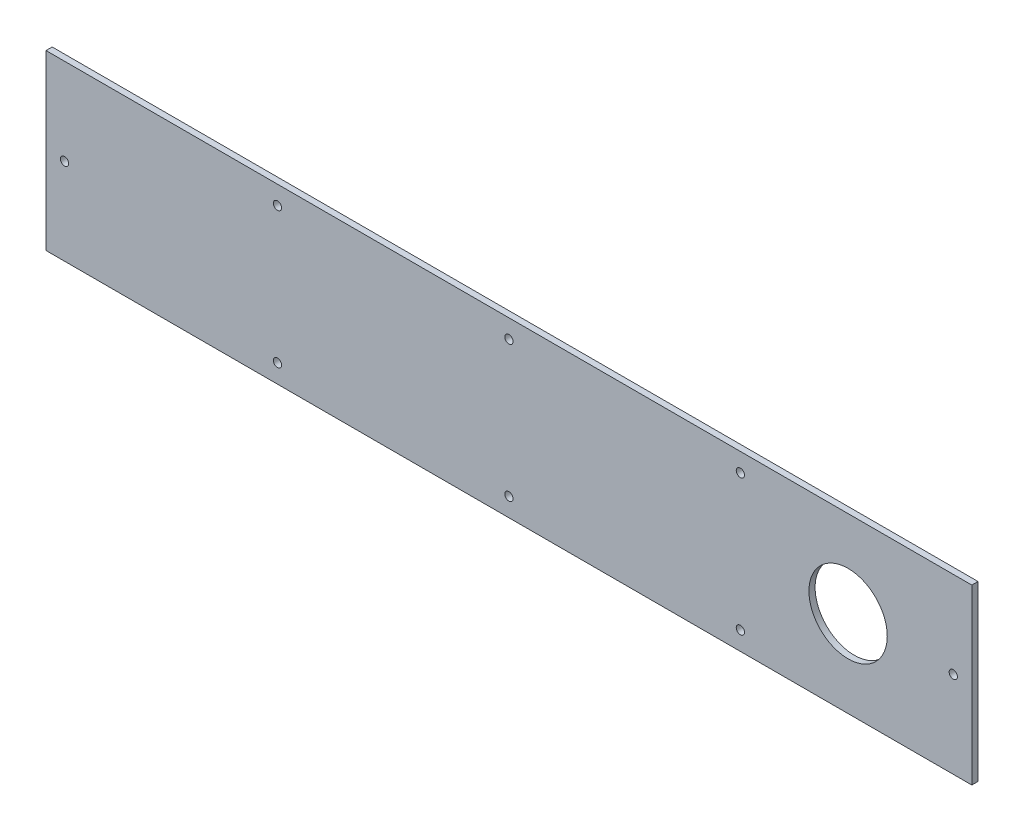
from build123d import *

# Parameters (mm, degrees)
SCHIZZO1_W                   = 449
SCHIZZO1_H                   = 84
SCHIZZO1_R                   = 2
SCHIZZO1_R_2                 = 19
ESTRUSIONE_ESTRUSIONE1_DEPTH = 3


with BuildPart() as part:
    # Schizzo1 → Estrusione-Estrusione1 (new body)
    with BuildSketch(Plane.XY):
        with Locations((224.5, 42)):
            Rectangle(SCHIZZO1_W, SCHIZZO1_H)
        with Locations((9, 42)):
            Circle(SCHIZZO1_R, mode=Mode.SUBTRACT)
        with Locations((224.5, 75)):
            Circle(SCHIZZO1_R, mode=Mode.SUBTRACT)
        with Locations((224.5, 9)):
            Circle(SCHIZZO1_R, mode=Mode.SUBTRACT)
        with Locations((440, 42)):
            Circle(SCHIZZO1_R, mode=Mode.SUBTRACT)
        with Locations((112.25, 75)):
            Circle(SCHIZZO1_R, mode=Mode.SUBTRACT)
        with Locations((336.75, 75)):
            Circle(SCHIZZO1_R, mode=Mode.SUBTRACT)
        with Locations((112.25, 9)):
            Circle(SCHIZZO1_R, mode=Mode.SUBTRACT)
        with Locations((336.75, 9)):
            Circle(SCHIZZO1_R, mode=Mode.SUBTRACT)
        with Locations((389, 42)):
            Circle(SCHIZZO1_R_2, mode=Mode.SUBTRACT)
    extrude(amount=ESTRUSIONE_ESTRUSIONE1_DEPTH)


solid = part.part
